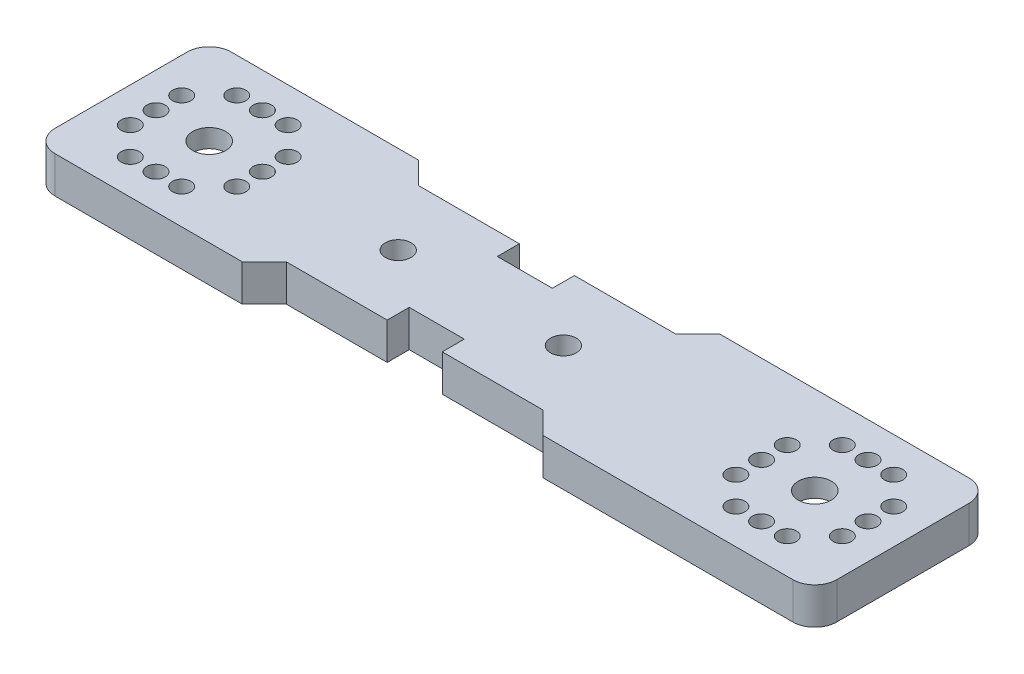
from build123d import *

# Parameters (mm, degrees)
BOSS_EXTRUDE1_DEPTH = 5
SKETCH2_R           = 10.5
CUT_EXTRUDE1_DEPTH  = 2.5
SKETCH3_R           = 2.25
SKETCH3_R_2         = 1.25
CUT_EXTRUDE2_DEPTH  = 59.792006259
SKETCH7_W           = 35
SKETCH7_H           = 3
CUT_EXTRUDE4_DEPTH  = 59.951251047
SKETCH6_W           = 7.5
SKETCH6_H           = 3
CUT_EXTRUDE3_DEPTH  = 59.951251047
SKETCH8_R           = 1.75
CUT_EXTRUDE5_DEPTH  = 59.951251047
FILLET3_R           = 3
CHAMFER1_SIZE       = 3


with BuildPart() as part:
    # Sketch1 → Boss-Extrude1 (new body)
    with BuildSketch(Plane(origin=(0, 0, 0), x_dir=(1, 0, 0), z_dir=(0, 1, 0))):
        Polygon((0, 12), (57.5, 12), (57.5, -12), (0, -12), (-49, -12), (-49, 12), align=None)
    extrude(amount=BOSS_EXTRUDE1_DEPTH)

    # Sketch2 → Cut-Extrude1 (cut)
    with BuildSketch(Plane.XZ):
        with Locations(Location((45.5, 0, 0), (0, 0, 270))):
            Circle(SKETCH2_R)
        with Locations(Location((-37, 0, 0), (0, 0, 90))):
            Circle(SKETCH2_R)
    extrude(amount=-CUT_EXTRUDE1_DEPTH, mode=Mode.SUBTRACT)

    # Sketch3 → Cut-Extrude2 (cut, through all)
    with BuildSketch(Plane.XZ.offset(-2.5)):
        with Locations(Location((45.5, 0, 0), (0, 0, 270))):
            Circle(SKETCH3_R)
        with Locations(Location((45.5, 7.25, 0), (0, 0, 270))):
            Circle(SKETCH3_R_2)
        with Locations(Location((42, 7.25, 0), (0, 0, 270))):
            Circle(SKETCH3_R_2)
        with Locations(Location((49, 7.25, 0), (0, 0, 270))):
            Circle(SKETCH3_R_2)
        with Locations(Location((52.75, 0, 0), (0, 0, 270))):
            Circle(SKETCH3_R_2)
        with Locations(Location((52.75, -3.5, 0), (0, 0, 270))):
            Circle(SKETCH3_R_2)
        with Locations(Location((52.75, 3.5, 0), (0, 0, 270))):
            Circle(SKETCH3_R_2)
        with Locations(Location((45.5, -7.25, 0), (0, 0, 270))):
            Circle(SKETCH3_R_2)
        with Locations(Location((42, -7.25, 0), (0, 0, 270))):
            Circle(SKETCH3_R_2)
        with Locations(Location((49, -7.25, 0), (0, 0, 270))):
            Circle(SKETCH3_R_2)
        with Locations(Location((38.25, 0, 0), (0, 0, 270))):
            Circle(SKETCH3_R_2)
        with Locations(Location((38.25, 3.5, 0), (0, 0, 270))):
            Circle(SKETCH3_R_2)
        with Locations(Location((38.25, -3.5, 0), (0, 0, 270))):
            Circle(SKETCH3_R_2)
        with Locations(Location((-37, 0, 0), (0, 0, 270))):
            Circle(SKETCH3_R)
        with Locations(Location((-37, 7.25, 0), (0, 0, 270))):
            Circle(SKETCH3_R_2)
        with Locations(Location((-40.5, 7.25, 0), (0, 0, 270))):
            Circle(SKETCH3_R_2)
        with Locations(Location((-33.5, 7.25, 0), (0, 0, 270))):
            Circle(SKETCH3_R_2)
        with Locations(Location((-29.75, 3.5, 0), (0, 0, 270))):
            Circle(SKETCH3_R_2)
        with Locations(Location((-29.75, 0, 0), (0, 0, 270))):
            Circle(SKETCH3_R_2)
        with Locations(Location((-29.75, -3.5, 0), (0, 0, 270))):
            Circle(SKETCH3_R_2)
        with Locations(Location((-33.5, -7.25, 0), (0, 0, 270))):
            Circle(SKETCH3_R_2)
        with Locations(Location((-37, -7.25, 0), (0, 0, 270))):
            Circle(SKETCH3_R_2)
        with Locations(Location((-40.5, -7.25, 0), (0, 0, 270))):
            Circle(SKETCH3_R_2)
        with Locations(Location((-44.25, -3.5, 0), (0, 0, 270))):
            Circle(SKETCH3_R_2)
        with Locations(Location((-44.25, 0, 0), (0, 0, 270))):
            Circle(SKETCH3_R_2)
        with Locations(Location((-44.25, 3.5, 0), (0, 0, 270))):
            Circle(SKETCH3_R_2)
    extrude(amount=-CUT_EXTRUDE2_DEPTH, mode=Mode.SUBTRACT)

    # Sketch7 → Cut-Extrude4 (cut, through all)
    with BuildSketch(Plane.XZ):
        with Locations((0, 10.5)):
            Rectangle(SKETCH7_W, SKETCH7_H)
        with Locations((0, -10.5)):
            Rectangle(SKETCH7_W, SKETCH7_H)
    extrude(amount=-CUT_EXTRUDE4_DEPTH, mode=Mode.SUBTRACT)

    # Sketch6 → Cut-Extrude3 (cut, through all)
    with BuildSketch(Plane.XZ):
        with Locations((0, 7.5)):
            Rectangle(SKETCH6_W, SKETCH6_H)
        with Locations((0, -7.5)):
            Rectangle(SKETCH6_W, SKETCH6_H)
    extrude(amount=-CUT_EXTRUDE3_DEPTH, mode=Mode.SUBTRACT)

    # Sketch8 → Cut-Extrude5 (cut, through all)
    with BuildSketch(Plane(origin=(0, 5, 0), x_dir=(1, 0, 0), z_dir=(0, 1, 0))):
        with Locations(Location((11.25, 0, 0), (0, 0, 270))):
            Circle(SKETCH8_R)
        with Locations(Location((-11.25, 0, 0), (0, 0, 90))):
            Circle(SKETCH8_R)
    extrude(amount=-CUT_EXTRUDE5_DEPTH, mode=Mode.SUBTRACT)

    # Fillet3
    fillet3_edges = [part.edges().sort_by_distance(p)[0] for p in [
        (-49, 2.5, 12),
        (-49, 2.5, -12),
        (57.5, 2.5, -12),
        (57.5, 2.5, 12),
    ]]
    fillet(fillet3_edges, radius=FILLET3_R)

    # Chamfer1
    chamfer1_edges = [part.edges().sort_by_distance(p)[0] for p in [
        (-17.5, 2.5, 12),
        (17.5, 2.5, 12),
        (17.5, 2.5, -12),
        (-17.5, 2.5, -12),
    ]]
    chamfer(chamfer1_edges, length=CHAMFER1_SIZE - 0.0001)  # a hair under: the kernel refuses the full size


solid = part.part
